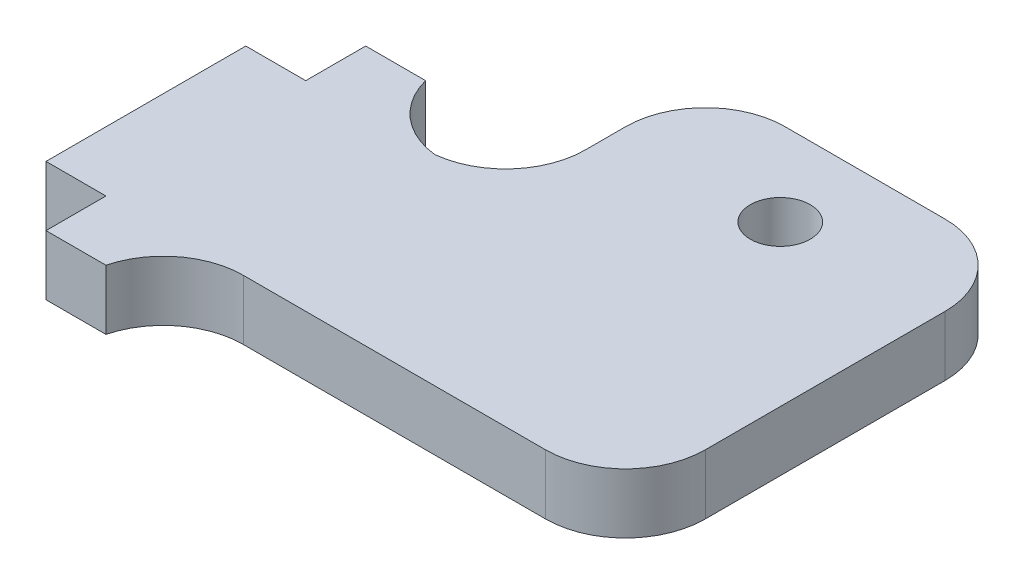
from build123d import *

# Parameters (mm, degrees)
SKETCH1_R           = 1.5
SKETCH1_W           = 3
SKETCH1_H           = 3
BOSS_EXTRUDE1_DEPTH = 3
FILLET1_R           = 4


with BuildPart() as part:
    # Sketch1 → Boss-Extrude1 (new body)
    # profile 1 of 3: a face of its own
    with BuildSketch(Plane(origin=(0, 0, 0), x_dir=(1, 0, 0), z_dir=(0, 1, 0))):
        Polygon((14.5, 10), (-1.5, 10), (-1.5, 0), (-8.5, 0), (-11.5, 0), (-14.5, 0), (-14.5, -10), (-11.5, -10), (-8.5, -10), (14.5, -10), align=None)
        with Locations(Location((6.5, 5.75, 0), (0, 0, 270))):
            Circle(SKETCH1_R, mode=Mode.SUBTRACT)
    # profile 2 of 3: a face of its own
    with BuildSketch(Plane(origin=(0, 0, 0), x_dir=(1, 0, 0), z_dir=(0, 1, 0))):
        with Locations((-10, -11.5)):
            Rectangle(SKETCH1_W, SKETCH1_H)
    # profile 3 of 3: a face of its own
    with BuildSketch(Plane(origin=(0, 0, 0), x_dir=(1, 0, 0), z_dir=(0, 1, 0))):
        with Locations((-10, 1.5)):
            Rectangle(SKETCH1_W, SKETCH1_H)
    extrude(amount=BOSS_EXTRUDE1_DEPTH)

    # Fillet1
    # the kernel refuses this fillet: 4 mm, written as the material it adds along each edge
    with BuildSketch(Plane(origin=(-8.5, 0, 0), x_dir=(1, 0, 0), z_dir=(0, 1, 0))) as fillet1_piece_1:
        with BuildLine():
            CenterArc((3.872983346, 4), FILLET1_R, 194.477512186, 75.522487814)
            Line((0, 3), (0, 0))
            Line((0, 0), (3.872983346, 0))
        make_face()
    extrude(amount=3)
    with BuildSketch(Plane(origin=(-8.5, 0, 10), x_dir=(1, 0, 0), z_dir=(0, 1, 0))) as fillet1_piece_2:
        with BuildLine():
            CenterArc((3.872983346, -4), FILLET1_R, 90, 75.522487814)
            Line((0, -3), (0, 0))
            Line((0, 0), (3.872983346, 0))
        make_face()
    extrude(amount=3)
    with BuildSketch(Plane(origin=(-1.5, 0, 0), x_dir=(0, 0, -1), z_dir=(0, 1, 0))) as fillet1_piece_3:
        with BuildLine():
            CenterArc((FILLET1_R, FILLET1_R), FILLET1_R, 180, 90)
            Line((0, FILLET1_R), (0, 0))
            Line((0, 0), (FILLET1_R, 0))
        make_face()
    extrude(amount=3)
    # the kernel refuses this fillet: 4 mm, written as the material it takes off along each edge
    with BuildSketch(Plane(origin=(14.5, -10, 10), x_dir=(0, 0, -1), z_dir=(0, 1, 0)), Plane(origin=(14.5, -10, -10), x_dir=(-1, 0, 0), z_dir=(0, 1, 0))) as fillet1_2_piece_1:
        with BuildLine():
            CenterArc((FILLET1_R, FILLET1_R), FILLET1_R, 180, 90)
            Line((0, FILLET1_R), (0, 0))
            Line((0, 0), (FILLET1_R, 0))
        make_face()
    extrude(amount=23, mode=Mode.SUBTRACT)
    with BuildSketch(Plane(origin=(-1.5, -10, -10), x_dir=(1, 0, 0), z_dir=(0, 1, 0))) as fillet1_2_piece_2:
        with BuildLine():
            CenterArc((FILLET1_R, -FILLET1_R), FILLET1_R, 90, 90)
            Line((0, -FILLET1_R), (0, 0))
            Line((0, 0), (FILLET1_R, 0))
        make_face()
    extrude(amount=23, mode=Mode.SUBTRACT)


solid = part.part
